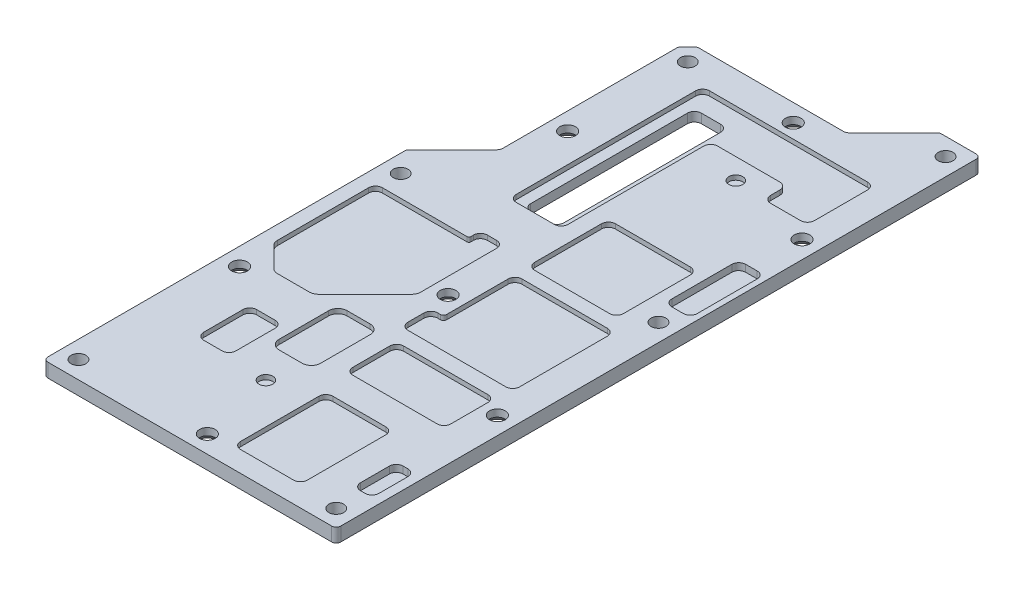
from build123d import *

# Parameters (mm, degrees)
BOSS_EXTRUDE1_DEPTH                                  = 3
F_3_2_3_2_DIAMETER_HOLE1_D                           = 3.2
F_3_2_3_2_DIAMETER_HOLE1_DEPTH                       = 3
F_3_2_3_2_DIAMETER_HOLE1_TIP                         = 0.96137699
CSK_FOR_M3_COUNTERSUNK_RAISED_HEAD_SCREW_D           = 3.4
CSK_FOR_M3_COUNTERSUNK_RAISED_HEAD_SCREW_DEPTH       = 3
CSK_FOR_M3_COUNTERSUNK_RAISED_HEAD_SCREW_CSINK_D     = 6.3
CSK_FOR_M3_COUNTERSUNK_RAISED_HEAD_SCREW_CSINK_ANGLE = 90
CSK_FOR_M3_COUNTERSUNK_RAISED_HEAD_SCREW_TIP         = 1.021463052
CUT_EXTRUDE1_START                                   = -1
CUT_EXTRUDE1_OUTLINE_R                               = 1.5
CUT_EXTRUDE1_DEPTH                                   = 1
CUT_EXTRUDE2_DEPTH                                   = 1.5


# Read off the part's stored shape, not the designer's step: Cut-Extrude1
with BuildPart() as part:
    # Sketch1 → Boss-Extrude1 (new body)
    with BuildSketch(Plane(origin=(0, 0, 0), x_dir=(1, 0, 0), z_dir=(0, 1, 0))):
        with BuildLine():
            Line((0, 1), (0, 78.325786438))
            ThreePointArc((0, 78.325786438), (0.076120467, 78.70846987), (0.292893219, 79.032893219))
            Line((0.292893219, 79.032893219), (9.720660172, 88.460660172))
            ThreePointArc((9.720660172, 88.460660172), (10.045819299, 88.947295195), (10.16, 89.521320344))
            Line((10.16, 89.521320344), (10.16, 127.095786438))
            ThreePointArc((10.16, 127.095786438), (10.236120467, 127.47846987), (10.452893219, 127.802893219))
            Line((10.452893219, 127.802893219), (11.897106781, 129.247106781))
            ThreePointArc((11.897106781, 129.247106781), (12.22153013, 129.463879533), (12.604213562, 129.54))
            Line((12.604213562, 129.54), (43.828679656, 129.54))
            ThreePointArc((43.828679656, 129.54), (44.402704805, 129.654180701), (44.889339828, 129.979339828))
            Line((44.889339828, 129.979339828), (54.317106781, 139.407106781))
            ThreePointArc((54.317106781, 139.407106781), (54.64153013, 139.623879533), (55.024213562, 139.7))
            Line((55.024213562, 139.7), (62.5, 139.7))
            ThreePointArc((62.5, 139.7), (63.207106781, 139.407106781), (63.5, 138.7))
            Line((63.5, 138.7), (63.5, 1))
            ThreePointArc((63.5, 1), (63.207106781, 0.292893219), (62.5, 0))
            Line((62.5, 0), (1, 0))
            ThreePointArc((1, 0), (0.292893219, 0.292893219), (0, 1))
        make_face()
        with BuildLine():
            Line((28.26, 118.58), (24.06, 118.58))
            ThreePointArc((24.06, 118.58), (22.999339828, 118.140660172), (22.56, 117.08))
            Line((22.56, 117.08), (22.56, 83.08))
            ThreePointArc((22.56, 83.08), (22.999339828, 82.019339828), (24.06, 81.58))
            Line((24.06, 81.58), (28.26, 81.58))
            ThreePointArc((28.26, 81.58), (29.320660172, 82.019339828), (29.76, 83.08))
            Line((29.76, 83.08), (29.76, 117.08))
            ThreePointArc((29.76, 117.08), (29.320660172, 118.140660172), (28.26, 118.58))
        make_face(mode=Mode.SUBTRACT)
    extrude(amount=-BOSS_EXTRUDE1_DEPTH)

    # Ø3.2 (3.2) Diameter Hole1
    with Locations(Plane(origin=(0, -3, 0), x_dir=(-1, 0, 0), z_dir=(0, -1, 0))):
        with Locations((-3.81, 3.81), (-59.69, 3.81), (-3.81, 73.66), (-59.69, 73.66), (-13.97, 125.73), (-59.69, 135.89)):
            Hole(F_3_2_3_2_DIAMETER_HOLE1_D / 2, depth=F_3_2_3_2_DIAMETER_HOLE1_DEPTH)
            with Locations((0, 0, -(F_3_2_3_2_DIAMETER_HOLE1_DEPTH + F_3_2_3_2_DIAMETER_HOLE1_TIP / 2))):  # 118° drill point
                Cone(0, F_3_2_3_2_DIAMETER_HOLE1_D / 2, F_3_2_3_2_DIAMETER_HOLE1_TIP, mode=Mode.SUBTRACT)

    # CSK for M3 Countersunk Raised Head Screw1
    with Locations(Plane(origin=(0, -3, 0), x_dir=(-1, 0, 0), z_dir=(0, -1, 0))):
        with Locations((-31.75, 3.81), (-3.81, 38.74), (-59.69, 38.74), (-31.75, 56), (-13.97, 99.69), (-59.69, 104.77), (-36.83, 125.73)):
            CounterSinkHole(CSK_FOR_M3_COUNTERSUNK_RAISED_HEAD_SCREW_D / 2, CSK_FOR_M3_COUNTERSUNK_RAISED_HEAD_SCREW_CSINK_D / 2, depth=CSK_FOR_M3_COUNTERSUNK_RAISED_HEAD_SCREW_DEPTH, counter_sink_angle=CSK_FOR_M3_COUNTERSUNK_RAISED_HEAD_SCREW_CSINK_ANGLE)
            with Locations((0, 0, -(CSK_FOR_M3_COUNTERSUNK_RAISED_HEAD_SCREW_DEPTH + CSK_FOR_M3_COUNTERSUNK_RAISED_HEAD_SCREW_TIP / 2))):  # 118° drill point
                Cone(0, CSK_FOR_M3_COUNTERSUNK_RAISED_HEAD_SCREW_D / 2, CSK_FOR_M3_COUNTERSUNK_RAISED_HEAD_SCREW_TIP, mode=Mode.SUBTRACT)

    # Cut-Extrude1 outline → Cut-Extrude1 (cut)
    # profile 1 of 10: a face of its own
    with BuildSketch(Plane(origin=(0, 0, 0), x_dir=(1, 0, 0), z_dir=(0, 1, 0)).offset(CUT_EXTRUDE1_START)):
        with BuildLine():
            Line((56.01, 122.65), (21.76, 122.65))
            ThreePointArc((21.76, 122.65), (20.699339828, 122.210660172), (20.26, 121.15))
            Line((20.26, 121.15), (20.26, 82.25))
            ThreePointArc((20.26, 82.25), (20.699339828, 81.189339828), (21.76, 80.75))
            Line((21.76, 80.75), (30.01, 80.75))
            ThreePointArc((30.01, 80.75), (31.070660172, 81.189339828), (31.51, 82.25))
            Line((31.51, 82.25), (31.51, 111.65))
            ThreePointArc((31.51, 111.65), (31.949339828, 112.710660172), (33.01, 113.15))
            Line((33.01, 113.15), (46.51, 113.15))
            ThreePointArc((46.51, 113.15), (47.570660172, 112.710660172), (48.01, 111.65))
            Line((48.01, 111.65), (48.01, 109.65))
            ThreePointArc((48.01, 109.65), (48.449339828, 108.589339828), (49.51, 108.15))
            Line((49.51, 108.15), (56.01, 108.15))
            ThreePointArc((56.01, 108.15), (57.070660172, 108.589339828), (57.51, 109.65))
            Line((57.51, 109.65), (57.51, 121.15))
            ThreePointArc((57.51, 121.15), (57.070660172, 122.210660172), (56.01, 122.65))
        make_face()
        with BuildLine():
            ThreePointArc((29.76, 83.08), (29.320660172, 82.019339828), (28.26, 81.58))
            Line((28.26, 81.58), (24.06, 81.58))
            ThreePointArc((24.06, 81.58), (22.999339828, 82.019339828), (22.56, 83.08))
            Line((22.56, 83.08), (22.56, 117.08))
            ThreePointArc((22.56, 117.08), (22.999339828, 118.140660172), (24.06, 118.58))
            Line((24.06, 118.58), (28.26, 118.58))
            ThreePointArc((28.26, 118.58), (29.320660172, 118.140660172), (29.76, 117.08))
            Line((29.76, 117.08), (29.76, 83.08))
        make_face(mode=Mode.SUBTRACT)
    # profile 2 of 10: a face of its own
    with BuildSketch(Plane(origin=(0, 0, 0), x_dir=(1, 0, 0), z_dir=(0, 1, 0)).offset(CUT_EXTRUDE1_START)):
        with BuildLine():
            Line((49.76, 24.49), (38.26, 24.49))
            ThreePointArc((38.26, 24.49), (37.199339828, 24.050660172), (36.76, 22.99))
            Line((36.76, 22.99), (36.76, 5.99))
            ThreePointArc((36.76, 5.99), (37.199339828, 4.929339828), (38.26, 4.49))
            Line((38.26, 4.49), (49.76, 4.49))
            ThreePointArc((49.76, 4.49), (50.820660172, 4.929339828), (51.26, 5.99))
            Line((51.26, 5.99), (51.26, 22.99))
            ThreePointArc((51.26, 22.99), (50.820660172, 24.050660172), (49.76, 24.49))
        make_face()
    # profile 3 of 10: a face of its own
    with BuildSketch(Plane(origin=(0, 0, 0), x_dir=(1, 0, 0), z_dir=(0, 1, 0)).offset(CUT_EXTRUDE1_START)):
        with BuildLine():
            ThreePointArc((23.76, 42.1), (22.345786438, 41.514213562), (21.76, 40.1))
            Line((21.76, 40.1), (21.76, 29.35))
            ThreePointArc((21.76, 29.35), (22.345786438, 27.935786438), (23.76, 27.35))
            Line((23.76, 27.35), (28.76, 27.35))
            ThreePointArc((28.76, 27.35), (30.174213562, 27.935786438), (30.76, 29.35))
            Line((30.76, 29.35), (30.76, 40.1))
            ThreePointArc((30.76, 40.1), (30.174213562, 41.514213562), (28.76, 42.1))
            Line((28.76, 42.1), (23.76, 42.1))
        make_face()
    # profile 4 of 10: a face of its own
    with BuildSketch(Plane(origin=(0, 0, 0), x_dir=(1, 0, 0), z_dir=(0, 1, 0)).offset(CUT_EXTRUDE1_START)):
        with BuildLine():
            Line((17.76, 32.5), (13.76, 32.5))
            ThreePointArc((13.76, 32.5), (12.699339828, 32.060660172), (12.26, 31))
            Line((12.26, 31), (12.26, 22.5))
            ThreePointArc((12.26, 22.5), (12.699339828, 21.439339828), (13.76, 21))
            Line((13.76, 21), (17.76, 21))
            ThreePointArc((17.76, 21), (18.820660172, 21.439339828), (19.26, 22.5))
            Line((19.26, 22.5), (19.26, 31))
            ThreePointArc((19.26, 31), (18.820660172, 32.060660172), (17.76, 32.5))
        make_face()
    # profile 5 of 10: a face of its own
    with BuildSketch(Plane(origin=(0, 0, 0), x_dir=(1, 0, 0), z_dir=(0, 1, 0)).offset(CUT_EXTRUDE1_START)):
        with Locations((28.01, 20.25)):
            Circle(CUT_EXTRUDE1_OUTLINE_R)
    # profile 6 of 10: a face of its own
    with BuildSketch(Plane(origin=(0, 0, 0), x_dir=(1, 0, 0), z_dir=(0, 1, 0)).offset(CUT_EXTRUDE1_START)):
        with BuildLine():
            Line((52.76, 87.5), (36.51, 87.5))
            ThreePointArc((36.51, 87.5), (35.449339828, 87.060660172), (35.01, 86))
            Line((35.01, 86), (35.01, 71.5))
            ThreePointArc((35.01, 71.5), (35.449339828, 70.439339828), (36.51, 70))
            Line((36.51, 70), (52.76, 70))
            ThreePointArc((52.76, 70), (53.820660172, 70.439339828), (54.26, 71.5))
            Line((54.26, 71.5), (54.26, 86))
            ThreePointArc((54.26, 86), (53.820660172, 87.060660172), (52.76, 87.5))
        make_face()
    # profile 7 of 10: a face of its own
    with BuildSketch(Plane(origin=(0, 0, 0), x_dir=(1, 0, 0), z_dir=(0, 1, 0)).offset(CUT_EXTRUDE1_START)):
        with BuildLine():
            ThreePointArc((36.51, 41.6), (35.449339828, 41.160660172), (35.01, 40.1))
            Line((35.01, 40.1), (35.01, 32.1))
            ThreePointArc((35.01, 32.1), (35.449339828, 31.039339828), (36.51, 30.6))
            Line((36.51, 30.6), (54.76, 30.6))
            ThreePointArc((54.76, 30.6), (55.820660172, 31.039339828), (56.26, 32.1))
            Line((56.26, 32.1), (56.26, 40.1))
            ThreePointArc((56.26, 40.1), (55.820660172, 41.160660172), (54.76, 41.6))
            Line((54.76, 41.6), (36.51, 41.6))
        make_face()
    # profile 8 of 10: a face of its own
    with BuildSketch(Plane(origin=(0, 0, 0), x_dir=(1, 0, 0), z_dir=(0, 1, 0)).offset(CUT_EXTRUDE1_START)):
        with BuildLine():
            Line((34.56, 51.5), (34.01, 51.5))
            ThreePointArc((34.01, 51.5), (32.949339828, 51.060660172), (32.51, 50))
            Line((32.51, 50), (32.51, 46.5))
            ThreePointArc((32.51, 46.5), (32.949339828, 45.439339828), (34.01, 45))
            Line((34.01, 45), (55.26, 45))
            ThreePointArc((55.26, 45), (56.320660172, 45.439339828), (56.76, 46.5))
            Line((56.76, 46.5), (56.76, 65.5))
            ThreePointArc((56.76, 65.5), (56.320660172, 66.560660172), (55.26, 67))
            Line((55.26, 67), (36.76, 67))
            ThreePointArc((36.76, 67), (35.699339828, 66.560660172), (35.26, 65.5))
            Line((35.26, 65.5), (35.26, 52.2))
            ThreePointArc((35.26, 52.2), (35.054974747, 51.705025253), (34.56, 51.5))
        make_face()
    # profile 9 of 10: a face of its own
    with BuildSketch(Plane(origin=(0, 0, 0), x_dir=(1, 0, 0), z_dir=(0, 1, 0)).offset(CUT_EXTRUDE1_START)):
        with BuildLine():
            Line((28.26, 53.474873734), (28.26, 70))
            ThreePointArc((28.26, 70), (27.820660172, 71.060660172), (26.76, 71.5))
            Line((26.76, 71.5), (24.76, 71.5))
            ThreePointArc((24.76, 71.5), (23.699339828, 71.060660172), (23.26, 70))
            Line((23.26, 70), (23.26, 69.4))
            ThreePointArc((23.26, 69.4), (23.142842712, 69.117157288), (22.86, 69))
            Line((22.86, 69), (4.51, 69))
            ThreePointArc((4.51, 69), (3.449339828, 68.560660172), (3.01, 67.5))
            Line((3.01, 67.5), (3.01, 47.724873734))
            ThreePointArc((3.01, 47.724873734), (3.143210818, 47.055177727), (3.522563133, 46.487436867))
            Line((3.522563133, 46.487436867), (7.997436867, 42.012563133))
            ThreePointArc((7.997436867, 42.012563133), (8.565177727, 41.633210818), (9.234873734, 41.5))
            Line((9.234873734, 41.5), (16.181572875, 41.5))
            ThreePointArc((16.181572875, 41.5), (16.94693974, 41.652240935), (17.595786438, 42.085786438))
            Line((17.595786438, 42.085786438), (27.747436867, 52.237436867))
            ThreePointArc((27.747436867, 52.237436867), (28.126789182, 52.805177727), (28.26, 53.474873734))
        make_face()
    # profile 10 of 10: a face of its own
    with BuildSketch(Plane(origin=(0, 0, 0), x_dir=(1, 0, 0), z_dir=(0, 1, 0)).offset(CUT_EXTRUDE1_START)):
        with Locations((41.46, 108.65)):
            Circle(CUT_EXTRUDE1_OUTLINE_R)
    extrude(amount=CUT_EXTRUDE1_DEPTH, mode=Mode.SUBTRACT)

    # Sketch7 → Cut-Extrude2 (cut)
    with BuildSketch(Plane(origin=(0, 0, 0), x_dir=(1, 0, 0), z_dir=(0, 1, 0))):
        with BuildLine():
            Line((59.01, 19), (60.01, 19))
            ThreePointArc((60.01, 19), (61.070660172, 18.560660172), (61.51, 17.5))
            Line((61.51, 17.5), (61.51, 11.25))
            ThreePointArc((61.51, 11.25), (61.070660172, 10.189339828), (60.01, 9.75))
            Line((60.01, 9.75), (59.01, 9.75))
            ThreePointArc((59.01, 9.75), (57.949339828, 10.189339828), (57.51, 11.25))
            Line((57.51, 11.25), (57.51, 17.5))
            ThreePointArc((57.51, 17.5), (57.949339828, 18.560660172), (59.01, 19))
        make_face()
        with BuildLine():
            Line((58.25, 94), (60.75, 94))
            ThreePointArc((60.75, 94), (61.810660172, 93.560660172), (62.25, 92.5))
            Line((62.25, 92.5), (62.25, 79.5))
            ThreePointArc((62.25, 79.5), (61.810660172, 78.439339828), (60.75, 78))
            Line((60.75, 78), (58.25, 78))
            ThreePointArc((58.25, 78), (57.189339828, 78.439339828), (56.75, 79.5))
            Line((56.75, 79.5), (56.75, 92.5))
            ThreePointArc((56.75, 92.5), (57.189339828, 93.560660172), (58.25, 94))
        make_face()
    extrude(amount=-CUT_EXTRUDE2_DEPTH, mode=Mode.SUBTRACT)


solid = part.part
